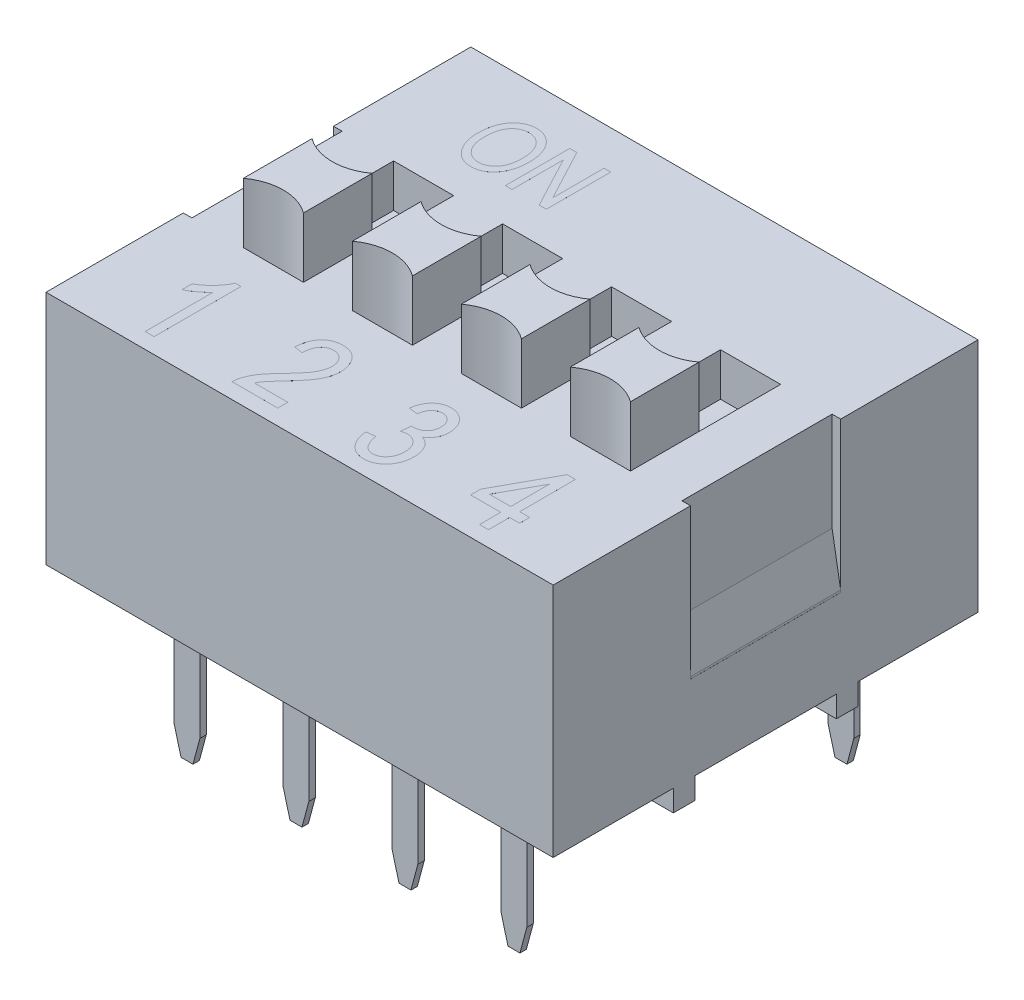
from build123d import *
from OCP.BRepFilletAPI import BRepFilletAPI_MakeChamfer

# Parameters (mm, degrees)
SKETCH_1_W                          = 11.82
SKETCH_1_H                          = 9.9
EXTRUDE_1_DEPTH                     = 5.5
SKETCH_2_W                          = 1.4
SKETCH_2_H                          = 3.5
CUT_EXTRUDE_1_DEPTH                 = 1
EXTRUDE_2_DEPTH                     = 2.4
SKETCH_4_W                          = 3.5
SKETCH_4_H                          = 3.5
CUT_EXTRUDE_2_DEPTH                 = 0.2
SKETCH_5_W                          = 3.5
SKETCH_5_H                          = 1.2
EXTRUDE_3_DEPTH                     = 0.199
CHAMFER_1_SIZE                      = 1.15
CHAMFER_1_SIZE_2                    = 0.2
SKETCH_6_W                          = 3.5
SKETCH_6_H                          = 3.5
CUT_EXTRUDE_3_DEPTH                 = 0.2
SKETCH_7_W                          = 3.5
SKETCH_7_H                          = 1.2
EXTRUDE_4_DEPTH                     = 0.199
CHAMFER_2_SIZE                      = 1.15
CHAMFER_2_SIZE_2                    = 0.2
EXTRUDE_5_DEPTH                     = 0.0001
SKETCH_9_W                          = 11.82
SKETCH_9_H                          = 0.5
EXTRUDE_6_DEPTH                     = 0.5
SKETCH_10_W                         = 0.6
SKETCH_10_H                         = 0.15
EXTRUDE_7_DEPTH                     = 3.5
CHAMFER_3_SIZE                      = 0.6
CHAMFER_3_SIZE2                     = 0.160769515
PATTERN_LINEAR_1_COUNT              = 4
PATTERN_LINEAR_1_PITCH              = 2.54
PATTERN_LINEAR_1_COUNT_DIR2         = 2
PATTERN_LINEAR_1_PITCH_DIR2         = 7.62
CHAMFER_3_OF_PATTERN_LINEAR_1_SIZE  = 0.6
CHAMFER_3_OF_PATTERN_LINEAR_1_SIZE2 = 0.160769515


with BuildPart() as part:
    # Эскиз1 → Бобышка-Вытянуть1 (new body)
    with BuildSketch(Plane(origin=(0, 0, 0), x_dir=(1, 0, 0), z_dir=(0, 1, 0))):
        with Locations((5.91, 4.95)):
            Rectangle(SKETCH_1_W, SKETCH_1_H)
    extrude(amount=EXTRUDE_1_DEPTH)

    # Эскиз2 → Вырез-Вытянуть1 (cut)
    with BuildSketch(Plane(origin=(0, 5.5, 0), x_dir=(1, 0, 0), z_dir=(0, 1, 0))):
        with Locations((4.64, 4.95)):
            Rectangle(SKETCH_2_W, SKETCH_2_H)
        with Locations((2.1, 4.95)):
            Rectangle(SKETCH_2_W, SKETCH_2_H)
        with Locations((7.18, 4.95)):
            Rectangle(SKETCH_2_W, SKETCH_2_H)
        with Locations((9.72, 4.95)):
            Rectangle(SKETCH_2_W, SKETCH_2_H)
    extrude(amount=-CUT_EXTRUDE_1_DEPTH, mode=Mode.SUBTRACT)

    # Эскиз3 → Бобышка-Вытянуть2 (add)
    with BuildSketch(Plane(origin=(0, 4.5, 0), x_dir=(1, 0, 0), z_dir=(0, 1, 0))):
        with BuildLine():
            Line((1.4, 4.8), (1.4, 3.2))
            ThreePointArc((1.4, 3.2), (2.1, 3.42944442), (2.8, 3.2))
            Line((2.8, 3.2), (2.8, 4.8))
            ThreePointArc((2.8, 4.8), (2.1, 4.57055558), (1.4, 4.8))
        make_face()
        with BuildLine():
            Line((3.94, 4.8), (3.94, 3.2))
            ThreePointArc((3.94, 3.2), (4.64, 3.42944442), (5.34, 3.2))
            Line((5.34, 3.2), (5.34, 4.8))
            ThreePointArc((5.34, 4.8), (4.64, 4.57055558), (3.94, 4.8))
        make_face()
        with BuildLine():
            Line((6.48, 4.8), (6.48, 3.2))
            ThreePointArc((6.48, 3.2), (7.18, 3.42944442), (7.88, 3.2))
            Line((7.88, 3.2), (7.88, 4.8))
            ThreePointArc((7.88, 4.8), (7.18, 4.57055558), (6.48, 4.8))
        make_face()
        with BuildLine():
            Line((9.02, 4.8), (9.02, 3.2))
            ThreePointArc((9.02, 3.2), (9.72, 3.42944442), (10.42, 3.2))
            Line((10.42, 3.2), (10.42, 4.8))
            ThreePointArc((10.42, 4.8), (9.72, 4.57055558), (9.02, 4.8))
        make_face()
    extrude(amount=EXTRUDE_2_DEPTH)

    # Эскиз4 → Вырез-Вытянуть2 (cut)
    with BuildSketch(Plane(origin=(11.82, 0, 0), x_dir=(0, 0, -1), z_dir=(1, 0, 0))):
        with Locations((4.95, 3.75)):
            Rectangle(SKETCH_4_W, SKETCH_4_H)
    extrude(amount=-CUT_EXTRUDE_2_DEPTH, mode=Mode.SUBTRACT)

    # Эскиз5 → Бобышка-Вытянуть3 (add)
    with BuildSketch(Plane(origin=(11.62, 0, 0), x_dir=(0, 0, -1), z_dir=(1, 0, 0))):
        with Locations((4.95, 2.6)):
            Rectangle(SKETCH_5_W, SKETCH_5_H)
    extrude(amount=EXTRUDE_3_DEPTH)

    # Фаска1
    # the kernel refuses this chamfer: 1.15, 0.2 mm, written as the material it takes off along each edge
    with BuildSketch(Plane(origin=(11.819, 3.2, -6.7), x_dir=(0.00659365225465628, -0.9999782616386943, 0), z_dir=(0, 0, 1))) as chamfer_1_piece_1_section:
        Polygon((CHAMFER_1_SIZE * 0.999978261639, -CHAMFER_1_SIZE * 0.00659365225466), (-CHAMFER_1_SIZE_2 * 0.00659365225466, -CHAMFER_1_SIZE_2 * 0.999978261639), (0, 0), align=None)
    chamfer_1_piece_1 = extrude(amount=3.5, mode=Mode.PRIVATE)
    chamfer_1_piece_1 = split(chamfer_1_piece_1, bisect_by=Plane(origin=(11.62, 2.785813605, -4.95), z_dir=(1, 0, 0)), keep=Keep.TOP, mode=Mode.PRIVATE)
    add(chamfer_1_piece_1, mode=Mode.SUBTRACT)

    # Эскиз6 → Вырез-Вытянуть3 (cut)
    with BuildSketch(Plane.ZY):
        with Locations((-4.95, 3.75)):
            Rectangle(SKETCH_6_W, SKETCH_6_H)
    extrude(amount=-CUT_EXTRUDE_3_DEPTH, mode=Mode.SUBTRACT)

    # Эскиз7 → Бобышка-Вытянуть4 (add)
    with BuildSketch(Plane.ZY.offset(-0.2)):
        with Locations((-4.95, 2.6)):
            Rectangle(SKETCH_7_W, SKETCH_7_H)
    extrude(amount=EXTRUDE_4_DEPTH)

    # Фаска2
    # the kernel refuses this chamfer: 1.15, 0.2 mm, written as the material it takes off along each edge
    with BuildSketch(Plane(origin=(0.001, 3.2, -3.2), x_dir=(-0.006593652254656159, -0.9999782616386943, 0), z_dir=(0, 0, -1))) as chamfer_2_piece_1_section:
        Polygon((CHAMFER_2_SIZE * 0.999978261639, -CHAMFER_2_SIZE * 0.00659365225466), (-CHAMFER_2_SIZE_2 * 0.00659365225466, -CHAMFER_2_SIZE_2 * 0.999978261639), (0, 0), align=None)
    chamfer_2_piece_1 = extrude(amount=3.5, mode=Mode.PRIVATE)
    chamfer_2_piece_1 = split(chamfer_2_piece_1, bisect_by=Plane(origin=(0.2, 2.785813605, -4.95), z_dir=(-1, 0, 0)), keep=Keep.TOP, mode=Mode.PRIVATE)
    add(chamfer_2_piece_1, mode=Mode.SUBTRACT)

    # Эскиз8 → Бобышка-Вытянуть5 (add)
    # profile 1 of 6: a face of its own
    with BuildSketch(Plane(origin=(0, 5.5, 0), x_dir=(1, 0, 0), z_dir=(0, 1, 0))):
        Polygon((3.200860231, 7.505186715), (3.200860231, 9.005186715), (3.36674903, 9.005186715), (3.99956153, 7.809569831), (3.99956153, 9.005186715), (4.155405686, 9.005186715), (4.155405686, 7.505186715), (3.988603738, 7.505186715), (3.356704387, 8.699281682), (3.356704387, 7.505186715), align=None)
    # profile 2 of 6: a face of its own
    with BuildSketch(Plane(origin=(0, 5.5, 0), x_dir=(1, 0, 0), z_dir=(0, 1, 0))):
        with BuildLine():
            add(Edge.make_bspline(
                [(1.817743348, 8.235401812), (1.818273173, 8.266160728), (1.819304936, 8.326059685), (1.827169738, 8.413147356), (1.840529657, 8.494728047), (1.858878464, 8.570880069), (1.882986868, 8.641466493), (1.912138139, 8.706761359), (1.946961712, 8.766460591), (1.986948489, 8.820302451), (2.030567206, 8.868385537), (2.077520676, 8.910060527), (2.126820245, 8.945699498), (2.179077022, 8.974362928), (2.233618178, 8.997419774), (2.291206265, 9.012852002), (2.351159003, 9.023168493), (2.392069968, 9.024163004), (2.412812342, 9.024667234)],
                knots=[0, 0, 0, 0, 1.331070849, 2.592086014, 3.780305682, 4.906005075, 5.978011684, 7.003908552, 7.995748348, 8.962674125, 9.901370513, 10.800246893, 11.675154716, 12.528146756, 13.374603752, 14.231114787, 15.103152967, 16, 16, 16, 16], degree=3))
            add(Edge.make_bspline(
                [(2.412812342, 9.024667234), (2.426420546, 9.024365912), (2.453297842, 9.023770777), (2.493156203, 9.019289122), (2.532089873, 9.012515216), (2.570064833, 9.002209431), (2.60728883, 8.989549213), (2.643484771, 8.973668581), (2.678677393, 8.954873099), (2.713010032, 8.933760366), (2.745956276, 8.909602443), (2.777259296, 8.882812782), (2.80696411, 8.853501286), (2.834597088, 8.821436269), (2.860618664, 8.786922476), (2.884595195, 8.749721699), (2.906854527, 8.70992683), (2.92749601, 8.667804716), (2.946074199, 8.623318139), (2.962311493, 8.576704653), (2.975470038, 8.527798281), (2.986928352, 8.477078403), (2.995221108, 8.424071301), (3.001747286, 8.369162528), (3.005358551, 8.312053764), (3.005820189, 8.273352922), (3.006055036, 8.253664799)],
                knots=[0, 0, 0, 0, 0.899824171, 1.777224896, 2.649917024, 3.510973429, 4.376801712, 5.248254587, 6.121797682, 7.013780974, 7.911701495, 8.820786024, 9.736582303, 10.668970754, 11.617827344, 12.593151753, 13.593637019, 14.632021419, 15.69381936, 16.780371356, 17.893899404, 19.04171746, 20.217729733, 21.440466177, 22.69789874, 24, 24, 24, 24], degree=3))
            add(Edge.make_bspline(
                [(3.006055036, 8.253664799), (3.005565273, 8.226765176), (3.004606209, 8.174089864), (2.997758684, 8.096938146), (2.985306203, 8.023706124), (2.969295869, 7.954019278), (2.947492758, 7.888423085), (2.921243293, 7.826586), (2.890449457, 7.768330806), (2.865596484, 7.732633605), (2.853254712, 7.714906682)],
                knots=[0, 0, 0, 0, 1.133525988, 2.219690354, 3.25996653, 4.261750254, 5.229810789, 6.168477289, 7.090481605, 8, 8, 8, 8], degree=3))
            add(Edge.make_bspline(
                [(2.853254712, 7.714906682), (2.839017344, 7.696729575), (2.811188715, 7.661200258), (2.763855805, 7.614224204), (2.71324873, 7.574554874), (2.659457595, 7.541668301), (2.602109707, 7.516760358), (2.541661132, 7.498621768), (2.477831596, 7.487783998), (2.434161008, 7.486407757), (2.411899192, 7.485706195)],
                knots=[0, 0, 0, 0, 1.070119256, 2.09167529, 3.083880958, 4.046692552, 5.007570185, 5.975302747, 6.967876608, 8, 8, 8, 8], degree=3))
            add(Edge.make_bspline(
                [(2.411899192, 7.485706195), (2.389532843, 7.48638326), (2.345637559, 7.487712041), (2.281382043, 7.498931563), (2.220602629, 7.517570076), (2.16297133, 7.543274744), (2.10907398, 7.576850944), (2.058618075, 7.6177449), (2.011282654, 7.665755287), (1.9837337, 7.702290711), (1.969630523, 7.720994344)],
                knots=[0, 0, 0, 0, 1.027712946, 2.016947528, 2.987811303, 3.944031492, 4.90967079, 5.89821231, 6.924028725, 8, 8, 8, 8], degree=3))
            add(Edge.make_bspline(
                [(1.969630523, 7.720994344), (1.957430462, 7.739054867), (1.933102554, 7.775069008), (1.902412989, 7.832876626), (1.87608898, 7.893173312), (1.854934908, 7.956391679), (1.837983483, 8.022164145), (1.826273801, 8.090781215), (1.819161623, 8.162198951), (1.818221352, 8.210730123), (1.817743348, 8.235401812)],
                knots=[0, 0, 0, 0, 0.958933014, 1.912189966, 2.876424288, 3.85247362, 4.843745406, 5.863745303, 6.913996742, 8, 8, 8, 8], degree=3))
        make_face()
        with BuildLine():
            add(Edge.make_bspline(
                [(1.973587504, 8.232966747), (1.974029984, 8.210938017), (1.974890021, 8.168121436), (1.980582513, 8.105732051), (1.990590948, 8.047111993), (2.004595145, 7.992266878), (2.022039988, 7.941036068), (2.044161852, 7.893891899), (2.070083086, 7.850386342), (2.099879818, 7.810864569), (2.132653114, 7.775830574), (2.167109036, 7.7449632), (2.203679043, 7.719400195), (2.241493884, 7.697727071), (2.281383254, 7.681168487), (2.323017353, 7.669716043), (2.366291709, 7.662428301), (2.395737687, 7.661501318), (2.41068166, 7.66103087)],
                knots=[0, 0, 0, 0, 1.312267352, 2.550614609, 3.728111592, 4.851026838, 5.919546711, 6.947055793, 7.94734328, 8.931337301, 9.889295514, 10.801324679, 11.681722049, 12.542374657, 13.393208477, 14.246700222, 15.110192087, 16, 16, 16, 16], degree=3))
            add(Edge.make_bspline(
                [(2.41068166, 7.66103087), (2.425926867, 7.66151607), (2.456072176, 7.662475486), (2.500318613, 7.669576768), (2.542663403, 7.681407372), (2.582874206, 7.69849651), (2.62134196, 7.719771398), (2.657879159, 7.745944718), (2.69235546, 7.776964997), (2.724931794, 7.81244933), (2.754428483, 7.852750865), (2.780534075, 7.897397789), (2.802077527, 7.946817999), (2.819523425, 8.000605662), (2.833720393, 8.058658239), (2.843024814, 8.121324531), (2.849426071, 8.188292288), (2.849944277, 8.234472228), (2.850210881, 8.258230546)],
                knots=[0, 0, 0, 0, 0.878770405, 1.737648083, 2.57658969, 3.407764765, 4.250999223, 5.106523145, 5.993164277, 6.920704469, 7.879005581, 8.867335561, 9.896730148, 10.980825599, 12.124467321, 13.338272289, 14.63061378, 16, 16, 16, 16], degree=3))
            add(Edge.make_bspline(
                [(2.850210881, 8.258230546), (2.850062137, 8.27386029), (2.849769182, 8.304643463), (2.84664554, 8.350259772), (2.841408954, 8.394517207), (2.834659341, 8.437683736), (2.824879069, 8.479296518), (2.814232944, 8.520003098), (2.800728519, 8.559256142), (2.790269968, 8.584679792), (2.785072894, 8.597313338)],
                knots=[0, 0, 0, 0, 1.078644903, 2.124418214, 3.153743212, 4.154196665, 5.137842886, 6.102739285, 7.057211248, 8, 8, 8, 8], degree=3))
            add(Edge.make_bspline(
                [(2.785072894, 8.597313338), (2.776290996, 8.615790761), (2.758936644, 8.652304931), (2.723455652, 8.701166678), (2.682383466, 8.744824694), (2.634964187, 8.781440335), (2.583801735, 8.811807159), (2.529346225, 8.833675513), (2.472395321, 8.846928643), (2.433579876, 8.848533997), (2.414029874, 8.849342559)],
                knots=[0, 0, 0, 0, 1.032714874, 2.040800129, 3.038924044, 4.055125724, 5.060150422, 6.038733642, 7.012177711, 8, 8, 8, 8], degree=3))
            add(Edge.make_bspline(
                [(2.414029874, 8.849342559), (2.398380237, 8.84885773), (2.367530656, 8.847902004), (2.322356827, 8.840857235), (2.279387981, 8.828896744), (2.238589695, 8.812264063), (2.19969, 8.791327895), (2.163213454, 8.764996712), (2.128784611, 8.734227736), (2.096731873, 8.698652166), (2.067158399, 8.658550834), (2.042447793, 8.612505727), (2.020641816, 8.562008494), (2.003551968, 8.505998217), (1.989724631, 8.445089903), (1.980861209, 8.378862909), (1.974317654, 8.307670777), (1.97383658, 8.258450528), (1.973587504, 8.232966747)],
                knots=[0, 0, 0, 0, 0.879508816, 1.733744975, 2.562624688, 3.381316754, 4.205651284, 5.039714663, 5.904114686, 6.796492674, 7.727389142, 8.697387403, 9.727116746, 10.814853576, 11.984051762, 13.234256004, 14.568036196, 16, 16, 16, 16], degree=3))
        make_face(mode=Mode.SUBTRACT)
    # profile 3 of 6: a face of its own
    with BuildSketch(Plane(origin=(0, 5.5, 0), x_dir=(1, 0, 0), z_dir=(0, 1, 0))):
        with BuildLine():
            Line((2.155844156, 0.362885472), (1.948051948, 0.362885472))
            Line((1.948051948, 0.362885472), (1.948051948, 1.947301056))
            add(Edge.make_bspline(
                [(1.948051948, 1.947301056), (1.93529067, 1.932611731), (1.908842934, 1.902168118), (1.862931021, 1.85887306), (1.811767267, 1.814227021), (1.755122197, 1.770904591), (1.697405381, 1.729408714), (1.640399298, 1.692912368), (1.586240512, 1.661157796), (1.549907611, 1.643897718), (1.532467532, 1.635612744)],
                knots=[0, 0, 0, 0, 0.892555828, 1.849821039, 2.893015883, 4.008277588, 5.121255548, 6.154629642, 7.114207698, 8, 8, 8, 8], degree=3))
            Line((1.532467532, 1.635612744), (1.532467532, 1.869378978))
            add(Edge.make_bspline(
                [(1.532467532, 1.869378978), (1.560495146, 1.886247063), (1.616310379, 1.919838794), (1.694514825, 1.978030521), (1.768393555, 2.040838923), (1.835738352, 2.108922092), (1.896038221, 2.179105646), (1.947794984, 2.24914892), (1.990232252, 2.318307714), (2.011049091, 2.365880985), (2.021103896, 2.388859498)],
                knots=[0, 0, 0, 0, 1.082272232, 2.155277244, 3.222407096, 4.289527553, 5.32168536, 6.282742408, 7.170542132, 8, 8, 8, 8], degree=3))
            Line((2.021103896, 2.388859498), (2.155844156, 2.388859498))
            Line((2.155844156, 2.388859498), (2.155844156, 0.362885472))
        make_face()
    # profile 4 of 6: a face of its own
    with BuildSketch(Plane(origin=(0, 5.5, 0), x_dir=(1, 0, 0), z_dir=(0, 1, 0))):
        with BuildLine():
            Line((5.038961039, 0.596651705), (5.038961039, 0.362885472))
            Line((5.038961039, 0.362885472), (3.974025974, 0.362885472))
            add(Edge.make_bspline(
                [(3.974025974, 0.362885472), (3.973976667, 0.375065671), (3.97387677, 0.399742952), (3.977198035, 0.437365647), (3.984021859, 0.475899208), (3.992735187, 0.515857681), (4.005089735, 0.556715524), (4.020213994, 0.598671266), (4.03805929, 0.641620451), (4.058954503, 0.685817441), (4.083371611, 0.731686179), (4.112835984, 0.779034759), (4.146697855, 0.828712508), (4.185002005, 0.880416575), (4.228497573, 0.933656608), (4.275893566, 0.989222949), (4.327866388, 1.046999864), (4.364871147, 1.085398938), (4.383928571, 1.105174433)],
                knots=[0, 0, 0, 0, 0.672188691, 1.361865275, 2.08134618, 2.831455259, 3.618325166, 4.435686407, 5.292818481, 6.184803937, 7.133719261, 8.159707436, 9.261705982, 10.452168352, 11.710682541, 13.056179633, 14.483934645, 16, 16, 16, 16], degree=3))
            add(Edge.make_bspline(
                [(4.383928571, 1.105174433), (4.406075435, 1.128081573), (4.448717498, 1.172187489), (4.508732129, 1.237312578), (4.563261449, 1.297845539), (4.611215997, 1.354880986), (4.653447141, 1.407642113), (4.690379775, 1.456053484), (4.720248886, 1.501213764), (4.752499033, 1.55435132), (4.783244966, 1.617610738), (4.810426113, 1.691349599), (4.827988614, 1.762633135), (4.830129396, 1.809628851), (4.831168831, 1.83244716)],
                knots=[0, 0, 0, 0, 1.312560889, 2.527233899, 3.64818266, 4.668586789, 5.596397896, 6.432357998, 7.175835261, 7.825761013, 8.992224112, 10.065918602, 11.060925749, 12, 12, 12, 12], degree=3))
            add(Edge.make_bspline(
                [(4.831168831, 1.83244716), (4.831023896, 1.845044683), (4.830740823, 1.869648963), (4.825930385, 1.905580883), (4.819070068, 1.939757703), (4.810012416, 1.972426428), (4.79716971, 2.003050464), (4.781781982, 2.031842285), (4.763757443, 2.05893229), (4.743188706, 2.083922654), (4.720506069, 2.106467086), (4.696601752, 2.126720426), (4.670853904, 2.143112539), (4.644320767, 2.157382206), (4.616105736, 2.167723987), (4.586802945, 2.175607099), (4.556141287, 2.180051956), (4.535321808, 2.18072549), (4.524756494, 2.18106729)],
                knots=[0, 0, 0, 0, 1.164486654, 2.274364258, 3.346924328, 4.388668322, 5.404300818, 6.412115579, 7.404820287, 8.409522099, 9.400647826, 10.360464378, 11.301161788, 12.219192522, 13.141987859, 14.073903283, 15.022558797, 16, 16, 16, 16], degree=3))
            add(Edge.make_bspline(
                [(4.524756494, 2.18106729), (4.513365013, 2.18082831), (4.49112832, 2.180361812), (4.458716889, 2.174564492), (4.427660786, 2.166808824), (4.398117602, 2.154780459), (4.370303432, 2.139372856), (4.343817599, 2.120826874), (4.319178528, 2.098791955), (4.295889887, 2.073735614), (4.275474426, 2.045163445), (4.256730038, 2.014245234), (4.241969622, 1.979671288), (4.22941901, 1.942507694), (4.219589906, 1.902321249), (4.213019935, 1.859263511), (4.208201849, 1.81334498), (4.207931266, 1.781730326), (4.207792208, 1.765482874)],
                knots=[0, 0, 0, 0, 0.928788257, 1.813037313, 2.680996359, 3.53827917, 4.408273621, 5.272359245, 6.172129225, 7.102295458, 8.058839945, 9.034325244, 10.048074492, 11.120300332, 12.234644845, 13.420320921, 14.674247329, 16, 16, 16, 16], degree=3))
            Line((4.207792208, 1.765482874), (4, 1.7914569))
            add(Edge.make_bspline(
                [(4, 1.7914569), (4.0021414, 1.815569534), (4.006295813, 1.862349138), (4.017195836, 1.930069877), (4.032321581, 1.99290259), (4.050276784, 2.051474112), (4.072866499, 2.105057538), (4.098122516, 2.154628025), (4.128056945, 2.199108002), (4.161438773, 2.239047362), (4.19798844, 2.274481718), (4.237499947, 2.305067861), (4.279919639, 2.330851402), (4.324763081, 2.352531202), (4.372957209, 2.368720711), (4.423637419, 2.380470693), (4.477215914, 2.387431944), (4.513778283, 2.388376618), (4.532467532, 2.388859498)],
                knots=[0, 0, 0, 0, 1.296155121, 2.514599762, 3.669097984, 4.755193195, 5.79120272, 6.77953026, 7.729955905, 8.65570694, 9.562583864, 10.450894749, 11.325630111, 12.216772649, 13.112585423, 14.04224033, 14.999270054, 16, 16, 16, 16], degree=3))
            add(Edge.make_bspline(
                [(4.532467532, 2.388859498), (4.552646513, 2.388267166), (4.591938341, 2.387113797), (4.649137981, 2.379514012), (4.702487101, 2.366108506), (4.752223993, 2.347454535), (4.797751331, 2.322897096), (4.839809659, 2.293439777), (4.877697073, 2.258187106), (4.911413414, 2.218074542), (4.94121018, 2.174768212), (4.967209807, 2.129484684), (4.989762395, 2.0829743), (5.00738788, 2.034719527), (5.022107036, 1.985367983), (5.031353932, 1.934171562), (5.037863679, 1.881720977), (5.038593187, 1.846266538), (5.038961039, 1.828388718)],
                knots=[0, 0, 0, 0, 1.141256367, 2.222215694, 3.255808886, 4.246221905, 5.218350639, 6.173592628, 7.142736081, 8.136099926, 9.131465336, 10.11177911, 11.087094076, 12.050634184, 13.014356534, 13.995714735, 14.989343724, 16, 16, 16, 16], degree=3))
            add(Edge.make_bspline(
                [(5.038961039, 1.828388718), (5.038614452, 1.812281585), (5.037925794, 1.780277169), (5.033446016, 1.732524764), (5.025538377, 1.685414354), (5.015270657, 1.638492958), (5.000700692, 1.592487084), (4.984206714, 1.546666049), (4.964200797, 1.501546776), (4.940583316, 1.456248546), (4.912930313, 1.409168364), (4.879792869, 1.359446965), (4.841785521, 1.305755277), (4.797364469, 1.249049967), (4.748682133, 1.187700347), (4.69358781, 1.123252252), (4.633156424, 1.055137362), (4.590580753, 1.008919224), (4.568587662, 0.985044563)],
                knots=[0, 0, 0, 0, 0.78053567, 1.550902233, 2.321464013, 3.094364546, 3.87611052, 4.657966429, 5.453363508, 6.265521698, 7.132350641, 8.097801917, 9.160103787, 10.319208993, 11.587678713, 12.955014444, 14.427067756, 16, 16, 16, 16], degree=3))
            add(Edge.make_bspline(
                [(4.568587662, 0.985044563), (4.554625696, 0.970189711), (4.527943257, 0.941800895), (4.490157727, 0.900721924), (4.456250521, 0.863352895), (4.425483418, 0.830219893), (4.399377473, 0.800208658), (4.376743931, 0.774111974), (4.35825059, 0.751608177), (4.330534878, 0.716230799), (4.295578183, 0.666384396), (4.271427371, 0.619392245), (4.25974026, 0.596651705)],
                knots=[0, 0, 0, 0, 1.227496676, 2.345844757, 3.360613726, 4.265798447, 5.068085109, 5.75545707, 6.345771879, 6.821573405, 8.46188917, 10, 10, 10, 10], degree=3))
            Line((4.25974026, 0.596651705), (5.038961039, 0.596651705))
        make_face()
    # profile 5 of 6: a face of its own
    with BuildSketch(Plane(origin=(0, 5.5, 0), x_dir=(1, 0, 0), z_dir=(0, 1, 0))):
        with BuildLine():
            Line((6.545454545, 0.908340017), (6.753246753, 0.934314043))
            add(Edge.make_bspline(
                [(6.753246753, 0.934314043), (6.755926704, 0.918589607), (6.761148947, 0.887948435), (6.771424007, 0.843854484), (6.782638267, 0.802594007), (6.795635842, 0.764555428), (6.809803577, 0.729367198), (6.825514641, 0.697253684), (6.843080192, 0.668220263), (6.86206786, 0.642250106), (6.882536294, 0.61922023), (6.904392384, 0.59928149), (6.927840821, 0.582448148), (6.95265808, 0.568439218), (6.97923689, 0.558046805), (7.007055023, 0.550115326), (7.036521215, 0.545703968), (7.056669156, 0.545041936), (7.066964286, 0.544703654)],
                knots=[0, 0, 0, 0, 1.392235382, 2.712957193, 3.95076201, 5.123471921, 6.220028287, 7.260520794, 8.240826993, 9.178593426, 10.065213643, 10.926376853, 11.755607984, 12.580369742, 13.407158359, 14.241002189, 15.101193065, 16, 16, 16, 16], degree=3))
            add(Edge.make_bspline(
                [(7.066964286, 0.544703654), (7.078224521, 0.544917904), (7.100356703, 0.545339016), (7.132789907, 0.551612517), (7.164300555, 0.560177266), (7.194345301, 0.573517186), (7.2234532, 0.589908561), (7.251660705, 0.609684443), (7.277859325, 0.634132244), (7.303371772, 0.661006722), (7.32690224, 0.690841447), (7.347191061, 0.723427531), (7.36427823, 0.758287356), (7.37861672, 0.795004006), (7.388877567, 0.834174294), (7.397330086, 0.87501759), (7.40157001, 0.918397246), (7.402249241, 0.947970328), (7.402597403, 0.963128978)],
                knots=[0, 0, 0, 0, 0.904038564, 1.776903143, 2.648138989, 3.525264603, 4.411852617, 5.332561374, 6.2875971, 7.288147468, 8.311042921, 9.337403868, 10.368883854, 11.429611823, 12.501164111, 13.621320171, 14.780729868, 16, 16, 16, 16], degree=3))
            add(Edge.make_bspline(
                [(7.402597403, 0.963128978), (7.402229372, 0.977341979), (7.401512828, 1.005014239), (7.397571731, 1.045491166), (7.390350698, 1.08383909), (7.379561405, 1.119953263), (7.366784866, 1.154389977), (7.350476643, 1.186446143), (7.331231962, 1.216305235), (7.309459682, 1.24375533), (7.285421962, 1.268494355), (7.260071234, 1.290514162), (7.232996462, 1.308813316), (7.2048799, 1.324221536), (7.174954797, 1.335297117), (7.144093209, 1.34411299), (7.111626298, 1.348982063), (7.089571261, 1.349589034), (7.078327922, 1.349898459)],
                knots=[0, 0, 0, 0, 1.208507307, 2.352925112, 3.453685551, 4.520081629, 5.553915499, 6.572344605, 7.570902253, 8.569592363, 9.545641393, 10.499968035, 11.418701314, 12.319183888, 13.218416966, 14.125267075, 15.044288268, 16, 16, 16, 16], degree=3))
            add(Edge.make_bspline(
                [(7.078327922, 1.349898459), (7.068161048, 1.349578493), (7.046488068, 1.348896415), (7.012360877, 1.342997741), (6.974592724, 1.334707221), (6.948672213, 1.326571827), (6.935064935, 1.322301056)],
                knots=[0, 0, 0, 0, 0.832645691, 1.774971563, 2.831945141, 4, 4, 4, 4], degree=3))
            Line((6.935064935, 1.322301056), (6.961038961, 1.557690667))
            Line((6.961038961, 1.557690667), (6.992288961, 1.554849757))
            add(Edge.make_bspline(
                [(6.992288961, 1.554849757), (7.004348227, 1.554986522), (7.027879933, 1.555253397), (7.062295501, 1.560185122), (7.095125257, 1.566718982), (7.126037052, 1.576635352), (7.15540663, 1.588825262), (7.182776415, 1.604276343), (7.208645734, 1.622292762), (7.232552022, 1.642875391), (7.254012922, 1.666144921), (7.273184079, 1.691125164), (7.289030676, 1.718206549), (7.302198533, 1.746859455), (7.312295239, 1.777497998), (7.319663717, 1.809961213), (7.323580246, 1.844392418), (7.324304052, 1.867882039), (7.324675325, 1.879930926)],
                knots=[0, 0, 0, 0, 1.104467345, 2.155189185, 3.181695374, 4.170183668, 5.126157628, 6.092295424, 7.04536858, 8.012620263, 8.977961638, 9.942904556, 10.893715412, 11.848320646, 12.828840281, 13.845861792, 14.895045293, 16, 16, 16, 16], degree=3))
            add(Edge.make_bspline(
                [(7.324675325, 1.879930926), (7.323744003, 1.901513737), (7.321954168, 1.942992039), (7.308215141, 2.002069231), (7.284274263, 2.054361754), (7.251316606, 2.099070607), (7.211656298, 2.135098823), (7.167351036, 2.162098096), (7.118215146, 2.178095224), (7.083989177, 2.180064414), (7.066558442, 2.18106729)],
                knots=[0, 0, 0, 0, 1.168747258, 2.246123166, 3.262822778, 4.26410748, 5.234436762, 6.148309006, 7.056963545, 8, 8, 8, 8], degree=3))
            add(Edge.make_bspline(
                [(7.066558442, 2.18106729), (7.048446331, 2.180225156), (7.013211999, 2.178586912), (6.962829184, 2.162958767), (6.916476393, 2.139018236), (6.882687101, 2.110223813), (6.858742498, 2.082961636), (6.841847784, 2.059988802), (6.826835355, 2.034443266), (6.814112215, 2.00609693), (6.801866889, 1.975732334), (6.79320684, 1.942313586), (6.784556883, 1.90685918), (6.781037135, 1.882136859), (6.779220779, 1.869378978)],
                knots=[0, 0, 0, 0, 1.389180941, 2.702438466, 4.019316734, 5.377896697, 6.085434137, 6.807430375, 7.567469407, 8.358691296, 9.195188439, 10.081130764, 11.009773198, 12, 12, 12, 12], degree=3))
            Line((6.779220779, 1.869378978), (6.571428571, 1.895353004))
            add(Edge.make_bspline(
                [(6.571428571, 1.895353004), (6.574831032, 1.915154646), (6.581468217, 1.953781736), (6.595334847, 2.009363989), (6.611837976, 2.061289294), (6.631819307, 2.109271721), (6.654507206, 2.153727825), (6.680176457, 2.194469993), (6.708492715, 2.231765712), (6.740439726, 2.264584869), (6.77439402, 2.293815239), (6.810375315, 2.319059127), (6.847742092, 2.340787372), (6.887110243, 2.358292021), (6.928110107, 2.372172392), (6.97094697, 2.381885769), (7.015400727, 2.387627987), (7.04557299, 2.388445067), (7.060876623, 2.388859498)],
                knots=[0, 0, 0, 0, 1.259750421, 2.457396855, 3.589696629, 4.673763457, 5.713494597, 6.716289503, 7.690389722, 8.644478697, 9.583164327, 10.496506905, 11.397350125, 12.289843847, 13.194037124, 14.107891875, 15.040306322, 16, 16, 16, 16], degree=3))
            add(Edge.make_bspline(
                [(7.060876623, 2.388859498), (7.077001676, 2.388383846), (7.108725258, 2.387448073), (7.155352277, 2.38026797), (7.200194754, 2.369076574), (7.243133307, 2.352760207), (7.283786275, 2.331267611), (7.323155024, 2.306064774), (7.360575752, 2.275868777), (7.395461975, 2.241172956), (7.427484409, 2.203205948), (7.455571508, 2.162412478), (7.479695804, 2.119481232), (7.498852164, 2.073790301), (7.513825495, 2.025800959), (7.524767092, 1.975435162), (7.531467051, 1.922590725), (7.532128977, 1.886579881), (7.532467532, 1.868161446)],
                knots=[0, 0, 0, 0, 0.987546189, 1.94284647, 2.883618689, 3.814886987, 4.749064414, 5.696240478, 6.674807358, 7.688712876, 8.706405422, 9.713376545, 10.718845743, 11.717906576, 12.742863162, 13.794678478, 14.872046121, 16, 16, 16, 16], degree=3))
            add(Edge.make_bspline(
                [(7.532467532, 1.868161446), (7.531842361, 1.84592194), (7.530621411, 1.802488512), (7.518852728, 1.739484661), (7.500175862, 1.680376282), (7.474126243, 1.625556532), (7.441665383, 1.575307054), (7.402675835, 1.530858477), (7.358178419, 1.49145959), (7.324344543, 1.470761603), (7.307224026, 1.460288069)],
                knots=[0, 0, 0, 0, 1.090109576, 2.128968013, 3.132278696, 4.123864162, 5.09769889, 6.057339906, 7.016980922, 8, 8, 8, 8], degree=3))
            add(Edge.make_bspline(
                [(7.307224026, 1.460288069), (7.322950339, 1.455449248), (7.353677558, 1.445994804), (7.396068076, 1.424703875), (7.434720999, 1.399978494), (7.46925809, 1.37032144), (7.499975431, 1.335722673), (7.527404025, 1.295941954), (7.550970161, 1.250599082), (7.572260969, 1.200824189), (7.588945928, 1.146652721), (7.601764861, 1.089167739), (7.609034, 1.028386576), (7.609930897, 0.986822004), (7.61038961, 0.965564043)],
                knots=[0, 0, 0, 0, 0.945190562, 1.846782401, 2.71900073, 3.580139159, 4.456653473, 5.37426406, 6.352713278, 7.392141409, 8.485180558, 9.608884637, 10.777077804, 12, 12, 12, 12], degree=3))
            add(Edge.make_bspline(
                [(7.61038961, 0.965564043), (7.609991602, 0.942946402), (7.609214568, 0.898789765), (7.601088595, 0.834069541), (7.588790462, 0.772512202), (7.571247382, 0.713897709), (7.548577752, 0.658679537), (7.520582315, 0.606541903), (7.487851432, 0.55747941), (7.450167118, 0.512180177), (7.408961543, 0.471621514), (7.365782818, 0.43537693), (7.320304935, 0.404970632), (7.272915233, 0.379850979), (7.223401754, 0.36077619), (7.172029456, 0.346835475), (7.118501124, 0.338601655), (7.082143902, 0.337479945), (7.063717532, 0.336911446)],
                knots=[0, 0, 0, 0, 1.16797173, 2.280242353, 3.364490462, 4.408173669, 5.436152277, 6.443028727, 7.460738993, 8.478233232, 9.481512989, 10.444418881, 11.386528098, 12.302557467, 13.209825675, 14.12198051, 15.04819242, 16, 16, 16, 16], degree=3))
            add(Edge.make_bspline(
                [(7.063717532, 0.336911446), (7.046644726, 0.337362271), (7.013014947, 0.3382503), (6.963640502, 0.345792576), (6.91626311, 0.357897379), (6.871060948, 0.375161705), (6.827506031, 0.396751005), (6.786273399, 0.423632898), (6.746849809, 0.455299029), (6.709805593, 0.491533013), (6.675954428, 0.532093514), (6.645207883, 0.575821578), (6.618201564, 0.622947937), (6.596218408, 0.673933907), (6.577405907, 0.727759621), (6.562360421, 0.784854085), (6.551326928, 0.845377937), (6.547439199, 0.887061103), (6.545454545, 0.908340017)],
                knots=[0, 0, 0, 0, 0.959274814, 1.889566238, 2.800731978, 3.703256649, 4.604498869, 5.528396462, 6.464265966, 7.442996794, 8.436156864, 9.429840861, 10.444772988, 11.483305447, 12.546329121, 13.647537524, 14.799087218, 16, 16, 16, 16], degree=3))
        make_face()
    # profile 6 of 6: a face of its own
    with BuildSketch(Plane(origin=(0, 5.5, 0), x_dir=(1, 0, 0), z_dir=(0, 1, 0))):
        Polygon((9.74025974, 0.362885472), (9.74025974, 0.856391965), (9.038961039, 0.856391965), (9.038961039, 1.090158199), (9.752029221, 2.388859498), (9.948051948, 2.388859498), (9.948051948, 1.090158199), (10.181818182, 1.090158199), (10.181818182, 0.856391965), (9.948051948, 0.856391965), (9.948051948, 0.362885472), align=None)
        Polygon((9.74025974, 1.090158199), (9.74025974, 1.993973134), (9.243912338, 1.090158199), align=None, mode=Mode.SUBTRACT)
    extrude(amount=EXTRUDE_5_DEPTH)

    # Эскиз9 → Бобышка-Вытянуть6 (add)
    with BuildSketch(Plane.XZ):
        with Locations((5.91, -3.05)):
            Rectangle(SKETCH_9_W, SKETCH_9_H)
        with Locations((5.91, -6.85)):
            Rectangle(SKETCH_9_W, SKETCH_9_H)
    extrude(amount=EXTRUDE_6_DEPTH)

    # Эскиз10 → Бобышка-Вытянуть7 (add)
    with BuildSketch(Plane.XZ):
        with Locations((2.1, -1.260726464)):
            Rectangle(SKETCH_10_W, SKETCH_10_H)
    extrude_7 = extrude(amount=EXTRUDE_7_DEPTH)

    # Фаска3: one chamfer whose edges measure the first distance from different faces: ONE call of the kernel's chamfer builder (chamfer() names one face for all edges)
    chamfer_3_edges_1 = [part.edges().sort_by_distance(p)[0] for p in [
        (2.4, -3.5, -1.260726464),
    ]]
    chamfer_3_side_1 = [part.faces().sort_by_distance(p)[0] for p in [
        (2.4, -1.75, -1.260726464),
    ]]
    chamfer_3_edges_2 = [part.edges().sort_by_distance(p)[0] for p in [
        (1.8, -3.5, -1.260726464),
    ]]
    chamfer_3_side_2 = [part.faces().sort_by_distance(p)[0] for p in [
        (1.8, -1.75, -1.260726464),
    ]]
    chamfer_3 = BRepFilletAPI_MakeChamfer(part.part.solid().wrapped)
    for e in chamfer_3_edges_1:
        chamfer_3.Add(CHAMFER_3_SIZE, CHAMFER_3_SIZE2, e.wrapped, chamfer_3_side_1[0].wrapped)  # the first distance lies on this face
    for e in chamfer_3_edges_2:
        chamfer_3.Add(CHAMFER_3_SIZE, CHAMFER_3_SIZE2, e.wrapped, chamfer_3_side_2[0].wrapped)  # the first distance lies on this face
    add(Compound.cast(chamfer_3.Shape()), mode=Mode.REPLACE)

    # Линейный массив1: Extrude 7 4 × 2
    with Locations(*[(i * PATTERN_LINEAR_1_PITCH, 0, -j * PATTERN_LINEAR_1_PITCH_DIR2) for i in range(PATTERN_LINEAR_1_COUNT) for j in range(PATTERN_LINEAR_1_COUNT_DIR2) if (i, j) != (0, 0)]):
        add(extrude_7)

    # Фаска3 of Линейный массив1: one chamfer whose edges measure the first distance from different faces: ONE call of the kernel's chamfer builder (chamfer() names one face for all edges)
    chamfer_3_of_pattern_linear_1_edges_1 = [part.edges().sort_by_distance(p)[0] for p in [
        (2.4, -3.5, -8.880726464),
    ]]
    chamfer_3_of_pattern_linear_1_side_1 = [part.faces().sort_by_distance(p)[0] for p in [
        (2.4, -1.75, -8.880726464),
    ]]
    chamfer_3_of_pattern_linear_1_edges_2 = [part.edges().sort_by_distance(p)[0] for p in [
        (1.8, -3.5, -8.880726464),
    ]]
    chamfer_3_of_pattern_linear_1_side_2 = [part.faces().sort_by_distance(p)[0] for p in [
        (1.8, -1.75, -8.880726464),
    ]]
    chamfer_3_of_pattern_linear_1_edges_3 = [part.edges().sort_by_distance(p)[0] for p in [
        (4.94, -3.5, -1.260726464),
    ]]
    chamfer_3_of_pattern_linear_1_side_3 = [part.faces().sort_by_distance(p)[0] for p in [
        (4.94, -1.75, -1.260726464),
    ]]
    chamfer_3_of_pattern_linear_1_edges_4 = [part.edges().sort_by_distance(p)[0] for p in [
        (4.34, -3.5, -1.260726464),
    ]]
    chamfer_3_of_pattern_linear_1_side_4 = [part.faces().sort_by_distance(p)[0] for p in [
        (4.34, -1.75, -1.260726464),
    ]]
    chamfer_3_of_pattern_linear_1_edges_5 = [part.edges().sort_by_distance(p)[0] for p in [
        (4.94, -3.5, -8.880726464),
    ]]
    chamfer_3_of_pattern_linear_1_side_5 = [part.faces().sort_by_distance(p)[0] for p in [
        (4.94, -1.75, -8.880726464),
    ]]
    chamfer_3_of_pattern_linear_1_edges_6 = [part.edges().sort_by_distance(p)[0] for p in [
        (4.34, -3.5, -8.880726464),
    ]]
    chamfer_3_of_pattern_linear_1_side_6 = [part.faces().sort_by_distance(p)[0] for p in [
        (4.34, -1.75, -8.880726464),
    ]]
    chamfer_3_of_pattern_linear_1_edges_7 = [part.edges().sort_by_distance(p)[0] for p in [
        (7.48, -3.5, -1.260726464),
    ]]
    chamfer_3_of_pattern_linear_1_side_7 = [part.faces().sort_by_distance(p)[0] for p in [
        (7.48, -1.75, -1.260726464),
    ]]
    chamfer_3_of_pattern_linear_1_edges_8 = [part.edges().sort_by_distance(p)[0] for p in [
        (6.88, -3.5, -1.260726464),
    ]]
    chamfer_3_of_pattern_linear_1_side_8 = [part.faces().sort_by_distance(p)[0] for p in [
        (6.88, -1.75, -1.260726464),
    ]]
    chamfer_3_of_pattern_linear_1_edges_9 = [part.edges().sort_by_distance(p)[0] for p in [
        (7.48, -3.5, -8.880726464),
    ]]
    chamfer_3_of_pattern_linear_1_side_9 = [part.faces().sort_by_distance(p)[0] for p in [
        (7.48, -1.75, -8.880726464),
    ]]
    chamfer_3_of_pattern_linear_1_edges_10 = [part.edges().sort_by_distance(p)[0] for p in [
        (6.88, -3.5, -8.880726464),
    ]]
    chamfer_3_of_pattern_linear_1_side_10 = [part.faces().sort_by_distance(p)[0] for p in [
        (6.88, -1.75, -8.880726464),
    ]]
    chamfer_3_of_pattern_linear_1_edges_11 = [part.edges().sort_by_distance(p)[0] for p in [
        (10.02, -3.5, -1.260726464),
    ]]
    chamfer_3_of_pattern_linear_1_side_11 = [part.faces().sort_by_distance(p)[0] for p in [
        (10.02, -1.75, -1.260726464),
    ]]
    chamfer_3_of_pattern_linear_1_edges_12 = [part.edges().sort_by_distance(p)[0] for p in [
        (9.42, -3.5, -1.260726464),
    ]]
    chamfer_3_of_pattern_linear_1_side_12 = [part.faces().sort_by_distance(p)[0] for p in [
        (9.42, -1.75, -1.260726464),
    ]]
    chamfer_3_of_pattern_linear_1_edges_13 = [part.edges().sort_by_distance(p)[0] for p in [
        (10.02, -3.5, -8.880726464),
    ]]
    chamfer_3_of_pattern_linear_1_side_13 = [part.faces().sort_by_distance(p)[0] for p in [
        (10.02, -1.75, -8.880726464),
    ]]
    chamfer_3_of_pattern_linear_1_edges_14 = [part.edges().sort_by_distance(p)[0] for p in [
        (9.42, -3.5, -8.880726464),
    ]]
    chamfer_3_of_pattern_linear_1_side_14 = [part.faces().sort_by_distance(p)[0] for p in [
        (9.42, -1.75, -8.880726464),
    ]]
    chamfer_3_of_pattern_linear_1 = BRepFilletAPI_MakeChamfer(part.part.solid().wrapped)
    for e in chamfer_3_of_pattern_linear_1_edges_1:
        chamfer_3_of_pattern_linear_1.Add(CHAMFER_3_OF_PATTERN_LINEAR_1_SIZE, CHAMFER_3_OF_PATTERN_LINEAR_1_SIZE2, e.wrapped, chamfer_3_of_pattern_linear_1_side_1[0].wrapped)  # the first distance lies on this face
    for e in chamfer_3_of_pattern_linear_1_edges_2:
        chamfer_3_of_pattern_linear_1.Add(CHAMFER_3_OF_PATTERN_LINEAR_1_SIZE, CHAMFER_3_OF_PATTERN_LINEAR_1_SIZE2, e.wrapped, chamfer_3_of_pattern_linear_1_side_2[0].wrapped)  # the first distance lies on this face
    for e in chamfer_3_of_pattern_linear_1_edges_3:
        chamfer_3_of_pattern_linear_1.Add(CHAMFER_3_OF_PATTERN_LINEAR_1_SIZE, CHAMFER_3_OF_PATTERN_LINEAR_1_SIZE2, e.wrapped, chamfer_3_of_pattern_linear_1_side_3[0].wrapped)  # the first distance lies on this face
    for e in chamfer_3_of_pattern_linear_1_edges_4:
        chamfer_3_of_pattern_linear_1.Add(CHAMFER_3_OF_PATTERN_LINEAR_1_SIZE, CHAMFER_3_OF_PATTERN_LINEAR_1_SIZE2, e.wrapped, chamfer_3_of_pattern_linear_1_side_4[0].wrapped)  # the first distance lies on this face
    for e in chamfer_3_of_pattern_linear_1_edges_5:
        chamfer_3_of_pattern_linear_1.Add(CHAMFER_3_OF_PATTERN_LINEAR_1_SIZE, CHAMFER_3_OF_PATTERN_LINEAR_1_SIZE2, e.wrapped, chamfer_3_of_pattern_linear_1_side_5[0].wrapped)  # the first distance lies on this face
    for e in chamfer_3_of_pattern_linear_1_edges_6:
        chamfer_3_of_pattern_linear_1.Add(CHAMFER_3_OF_PATTERN_LINEAR_1_SIZE, CHAMFER_3_OF_PATTERN_LINEAR_1_SIZE2, e.wrapped, chamfer_3_of_pattern_linear_1_side_6[0].wrapped)  # the first distance lies on this face
    for e in chamfer_3_of_pattern_linear_1_edges_7:
        chamfer_3_of_pattern_linear_1.Add(CHAMFER_3_OF_PATTERN_LINEAR_1_SIZE, CHAMFER_3_OF_PATTERN_LINEAR_1_SIZE2, e.wrapped, chamfer_3_of_pattern_linear_1_side_7[0].wrapped)  # the first distance lies on this face
    for e in chamfer_3_of_pattern_linear_1_edges_8:
        chamfer_3_of_pattern_linear_1.Add(CHAMFER_3_OF_PATTERN_LINEAR_1_SIZE, CHAMFER_3_OF_PATTERN_LINEAR_1_SIZE2, e.wrapped, chamfer_3_of_pattern_linear_1_side_8[0].wrapped)  # the first distance lies on this face
    for e in chamfer_3_of_pattern_linear_1_edges_9:
        chamfer_3_of_pattern_linear_1.Add(CHAMFER_3_OF_PATTERN_LINEAR_1_SIZE, CHAMFER_3_OF_PATTERN_LINEAR_1_SIZE2, e.wrapped, chamfer_3_of_pattern_linear_1_side_9[0].wrapped)  # the first distance lies on this face
    for e in chamfer_3_of_pattern_linear_1_edges_10:
        chamfer_3_of_pattern_linear_1.Add(CHAMFER_3_OF_PATTERN_LINEAR_1_SIZE, CHAMFER_3_OF_PATTERN_LINEAR_1_SIZE2, e.wrapped, chamfer_3_of_pattern_linear_1_side_10[0].wrapped)  # the first distance lies on this face
    for e in chamfer_3_of_pattern_linear_1_edges_11:
        chamfer_3_of_pattern_linear_1.Add(CHAMFER_3_OF_PATTERN_LINEAR_1_SIZE, CHAMFER_3_OF_PATTERN_LINEAR_1_SIZE2, e.wrapped, chamfer_3_of_pattern_linear_1_side_11[0].wrapped)  # the first distance lies on this face
    for e in chamfer_3_of_pattern_linear_1_edges_12:
        chamfer_3_of_pattern_linear_1.Add(CHAMFER_3_OF_PATTERN_LINEAR_1_SIZE, CHAMFER_3_OF_PATTERN_LINEAR_1_SIZE2, e.wrapped, chamfer_3_of_pattern_linear_1_side_12[0].wrapped)  # the first distance lies on this face
    for e in chamfer_3_of_pattern_linear_1_edges_13:
        chamfer_3_of_pattern_linear_1.Add(CHAMFER_3_OF_PATTERN_LINEAR_1_SIZE, CHAMFER_3_OF_PATTERN_LINEAR_1_SIZE2, e.wrapped, chamfer_3_of_pattern_linear_1_side_13[0].wrapped)  # the first distance lies on this face
    for e in chamfer_3_of_pattern_linear_1_edges_14:
        chamfer_3_of_pattern_linear_1.Add(CHAMFER_3_OF_PATTERN_LINEAR_1_SIZE, CHAMFER_3_OF_PATTERN_LINEAR_1_SIZE2, e.wrapped, chamfer_3_of_pattern_linear_1_side_14[0].wrapped)  # the first distance lies on this face
    add(Compound.cast(chamfer_3_of_pattern_linear_1.Shape()), mode=Mode.REPLACE)


solid = part.part
